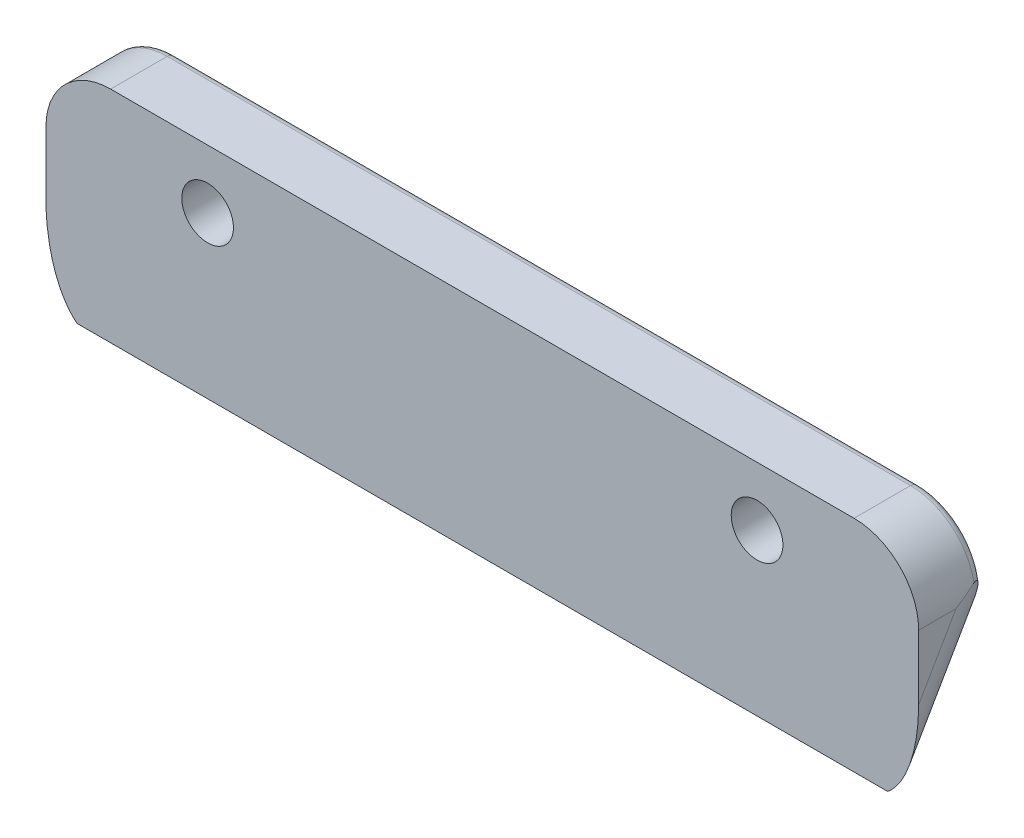
from build123d import *

# Parameters (mm, degrees)
WEDGE_GENERAL_SHAPE_DEPTH       = 73
SKETCH7_W                       = 10
SKETCH7_H                       = 0.2
KNIFE_EDGE_REMOVER_DEPTH        = 74.362115564
FILLET5_R                       = 1.5
FILLET2_START                   = -3
FILLET2_DEPTH                   = 4
BABY_WEDGE_SHORTENER_DEPTH      = 74.362115676
BABY_WEDGE_SHORTENER_DEPTH_BACK = 74.362115676
SKETCH11_W                      = 46
SKETCH11_H                      = 7
FILLET1_R                       = 1.5
FILLET3_START                   = -3
FILLET3_DEPTH                   = 4
BABY_WEDGE_M2_HOLES_D           = 1.6
BITEFILLET_R                    = 0.25


with BuildPart() as part:
    # Sketch2 → Wedge General Shape (new body)
    with BuildSketch(Plane(origin=(0, 0, 0), x_dir=(0, 0, -1), z_dir=(1, 0, 0))):
        Polygon((0, 7), (0, 0), (2, 3.464101615), (2, 7), align=None)
    extrude(amount=WEDGE_GENERAL_SHAPE_DEPTH)

    # Sketch7 → Knife Edge Remover (cut, through all)
    with BuildSketch(Plane(origin=(0, 0, 0), x_dir=(0, 0, -1), z_dir=(1, 0, 0))):
        with Locations((0, 0.1)):
            Rectangle(SKETCH7_W, SKETCH7_H)
    extrude(amount=KNIFE_EDGE_REMOVER_DEPTH, mode=Mode.SUBTRACT)

    # Fillet5
    fillet5_edges = [part.edges().sort_by_distance(p)[0] for p in [
        (73, 1.832050808, -1.057735027),
    ]]
    fillet(fillet5_edges, radius=FILLET5_R)

    # Fillet2: read off the stored shape, not the designer's step
    # Fillet2 outline → Fillet2 (cut)
    with BuildSketch(Plane.XY.offset(FILLET2_START)):
        with BuildLine():
            Line((73, 7), (71, 7))
            ThreePointArc((71, 7), (72.414213562, 6.414213562), (73, 5))
            Line((73, 5), (73, 7))
        make_face()
        with BuildLine():
            ThreePointArc((0, 5), (0.585786438, 6.414213562), (2, 7))
            Line((2, 7), (0, 7))
            Line((0, 7), (0, 5))
        make_face()
    extrude(amount=FILLET2_DEPTH, mode=Mode.SUBTRACT)

    # Sketch11 → Baby Wedge Shortener (cut, two sides: drawn at the far end of the back side and taken through both)
    with BuildSketch(Plane(origin=(0, 0, -2), x_dir=(-1, 0, 0), z_dir=(0, 0, -1)).offset(-BABY_WEDGE_SHORTENER_DEPTH_BACK)):
        with Locations((-23, 3.5)):
            Rectangle(SKETCH11_W, SKETCH11_H)
    extrude(amount=BABY_WEDGE_SHORTENER_DEPTH + BABY_WEDGE_SHORTENER_DEPTH_BACK, mode=Mode.SUBTRACT)

    # Fillet1
    fillet1_edges = [part.edges().sort_by_distance(p)[0] for p in [
        (46, 1.832050808, -1.057735027),
    ]]
    fillet(fillet1_edges, radius=FILLET1_R)

    # Fillet3: read off the stored shape, not the designer's step
    # Fillet3 outline → Fillet3 (cut)
    with BuildSketch(Plane.XY.offset(FILLET3_START)):
        with BuildLine():
            Line((46, 7), (46, 5))
            ThreePointArc((46, 5), (46.585786438, 6.414213562), (48, 7))
            Line((48, 7), (46, 7))
        make_face()
    extrude(amount=FILLET3_DEPTH, mode=Mode.SUBTRACT)

    # Baby Wedge M2 Holes (through all)
    with Locations(Plane(origin=(0, 0, -2), x_dir=(-1, 0, 0), z_dir=(0, 0, -1))):
        with Locations((-68, 5.18), (-51, 5.18)):
            Hole(BABY_WEDGE_M2_HOLES_D / 2)

    # BiteFillet
    bitefillet_edges = [part.edges().sort_by_distance(p)[0] for p in [
        (72.209561466, 6.592784059, -2),
        (46.790438534, 6.592784059, -2),
        (59.5, 7, -2),
    ]]
    fillet(bitefillet_edges, radius=BITEFILLET_R)


solid = part.part
